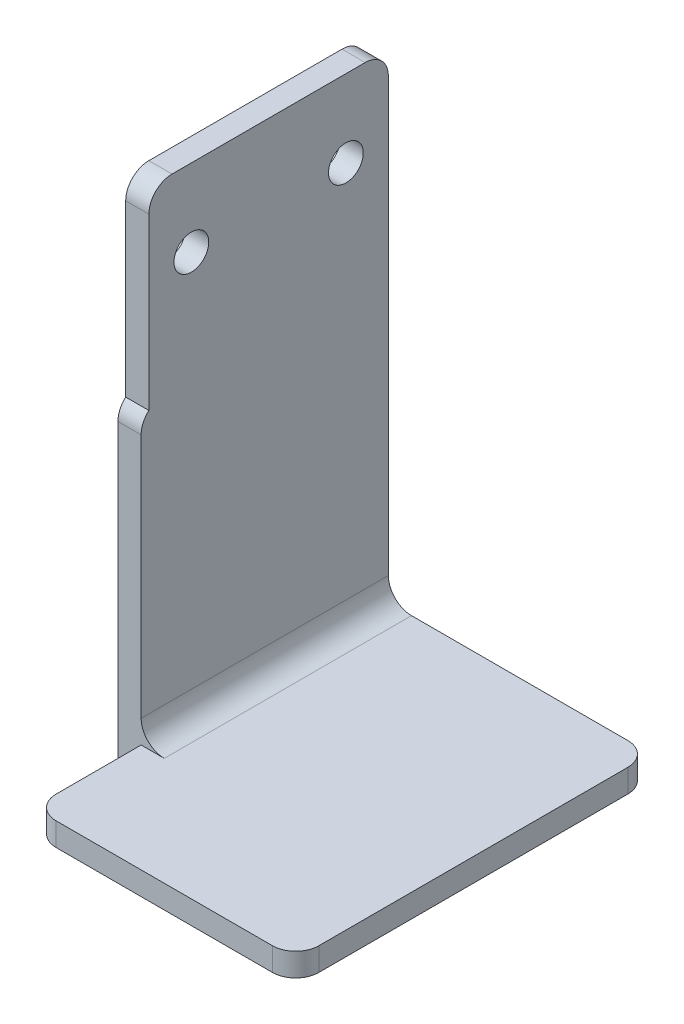
from build123d import *

# Parameters (mm, degrees)
BOSS_EXTRUDE1_DEPTH = 46
CUT_EXTRUDE1_DEPTH  = 3
SKETCH3_R           = 2.25
CUT_EXTRUDE2_DEPTH  = 46
FILLET1_R           = 3


with BuildPart() as part:
    # Sketch1 → Boss-Extrude1 (new body)
    with BuildSketch(Plane.XY):
        Polygon((0, 0), (0, 65), (3, 65), (3, 3), (37, 3), (37, 0), align=None)
    extrude(amount=BOSS_EXTRUDE1_DEPTH)

    # Sketch2 → Cut-Extrude1 (cut)
    with BuildSketch(Plane.ZY):
        Polygon((32, 65), (46, 65), (46, 0), (32, 0), (32, 40), (31, 40), (31, 65), align=None)
    extrude(amount=-CUT_EXTRUDE1_DEPTH, mode=Mode.SUBTRACT)

    # Sketch3 → Cut-Extrude2 (cut)
    with BuildSketch(Plane(origin=(3, 0, 0), x_dir=(0, 0, -1), z_dir=(1, 0, 0))):
        with Locations(Location((-25.5, 55, 0), (0, 0, 90))):
            Circle(SKETCH3_R)
        with Locations(Location((-5.5, 55, 0), (0, 0, 90))):
            Circle(SKETCH3_R)
    extrude(amount=-CUT_EXTRUDE2_DEPTH, mode=Mode.SUBTRACT)

    # Fillet1
    # the kernel refuses this fillet: 3 mm, written as the material it adds along each edge
    with BuildSketch(Plane(origin=(3, 3, 0), x_dir=(0, 1, 0), z_dir=(0, 0, 1))) as fillet1_piece_1:
        with BuildLine():
            CenterArc((FILLET1_R, -FILLET1_R), FILLET1_R, 90, 90)
            Line((0, -FILLET1_R), (0, 0))
            Line((0, 0), (FILLET1_R, 0))
        make_face()
    extrude(amount=32)
    # the kernel refuses this fillet: 3 mm, written as the material it takes off along each edge
    with BuildSketch(Plane(origin=(37, 10.5, 46), x_dir=(0, 0, -1), z_dir=(0, -1, 0)), Plane(origin=(37, 10.5, 0), x_dir=(-1, 0, 0), z_dir=(0, -1, 0)), Plane(origin=(-7.5, 65, 0), x_dir=(0, -1, 0), z_dir=(1, 0, 0)), Plane(origin=(-7.5, 65, 31), x_dir=(0, 0, -1), z_dir=(1, 0, 0))) as fillet1_2_piece_1:
        with BuildLine():
            CenterArc((FILLET1_R, -FILLET1_R), FILLET1_R, 90, 90)
            Line((0, -FILLET1_R), (0, 0))
            Line((0, 0), (FILLET1_R, 0))
        make_face()
    extrude(amount=18, mode=Mode.SUBTRACT)
    with BuildSketch(Plane(origin=(3, 10.5, 46), x_dir=(0, 0, -1), z_dir=(0, -1, 0))) as fillet1_2_piece_2:
        with BuildLine():
            CenterArc((FILLET1_R, FILLET1_R), FILLET1_R, 180, 90)
            Line((0, FILLET1_R), (0, 0))
            Line((0, 0), (FILLET1_R, 0))
        make_face()
    extrude(amount=18, mode=Mode.SUBTRACT)
    with BuildSketch(Plane(origin=(-5.590169944, 40, 32), x_dir=(0, -1, 0), z_dir=(1, 0, 0))) as fillet1_2_piece_3:
        with BuildLine():
            CenterArc((2.236067977, 3), FILLET1_R, 221.810314896, 48.189685104)
            Line((0, 1), (0, 0))
            Line((0, 0), (2.236067977, 0))
        make_face()
    extrude(amount=14.180339887, mode=Mode.SUBTRACT)


solid = part.part
